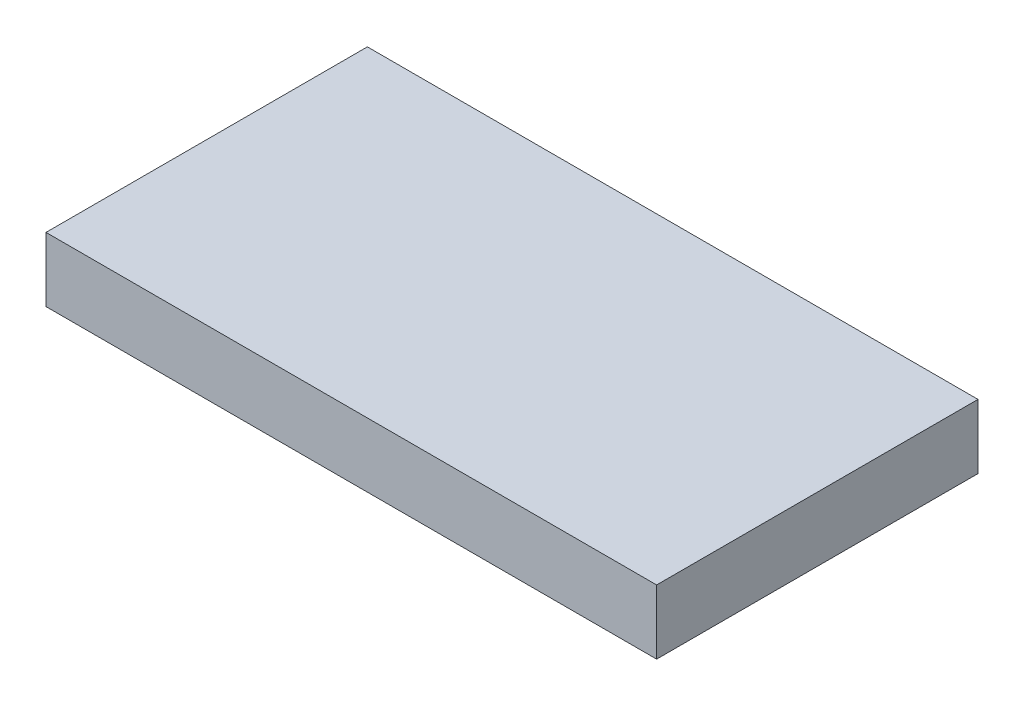
from build123d import *

# Parameters (mm, degrees)
SKETCH1_W           = 24.13
SKETCH1_H           = 12.7
BOSS_EXTRUDE1_DEPTH = 2.54


with BuildPart() as part:
    # Sketch1 → Boss-Extrude1 (new body)
    with BuildSketch(Plane(origin=(0, 0, 0), x_dir=(1, 0, 0), z_dir=(0, 1, 0))):
        Rectangle(SKETCH1_W, SKETCH1_H)
    extrude(amount=BOSS_EXTRUDE1_DEPTH)


solid = part.part
